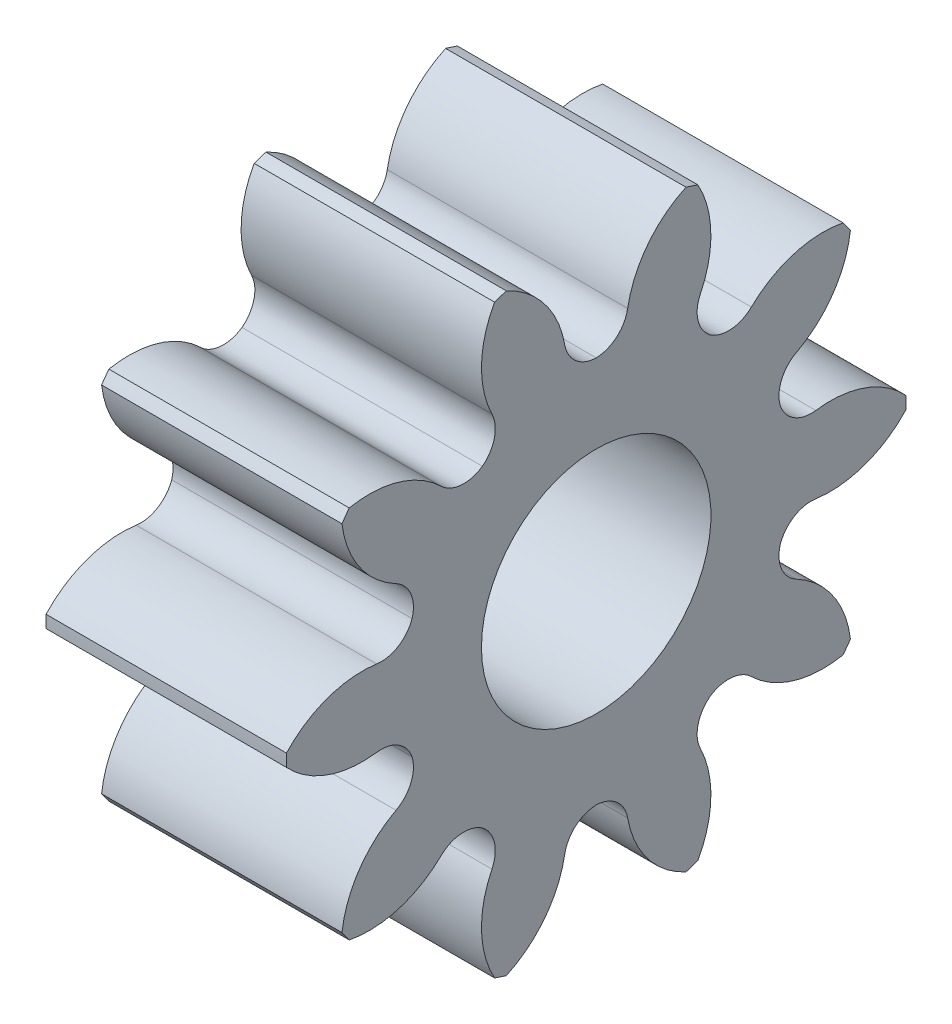
from build123d import *

# Parameters (mm, degrees)
BASPROSKE_W        = 10
BASPROSKE_H        = 6.75
TOOTHCUT_DEPTH     = 14.824796563
TEETHCUTS_COUNT    = 10
TEETHCUTS_ANGLE    = 324
BORSKE_R           = 2.5
BORE_DEPTH         = 50.0000508
SCALE1_SCALE       = 1.05
FILLET1_R          = 0.75
CUT_EXTRUDE1_START = -10.5
SKETCH1_R          = 10.265831804
CUT_EXTRUDE1_DEPTH = 5


with BuildPart() as part:
    # BasProSke → Base-Revolve (revolve)
    with BuildSketch(Plane(origin=(0, 0, 0), x_dir=(1, 0, 0), z_dir=(0, 1, 0)), mode=Mode.PRIVATE) as base_revolve_sk:
        with Locations((5, 3.375)):
            Rectangle(BASPROSKE_W, BASPROSKE_H)
    revolve(base_revolve_sk.sketch.rotate(Axis((-10, 0, 0), (1, 0, 0)), 180), axis=Axis((-10, 0, 0), (1, 0, 0)))

    # TooCutSke → ToothCut (cut, through all)
    with BuildSketch(Plane(origin=(0, 0, 0), x_dir=(0, 0, -1), z_dir=(1, 0, 0))):
        with BuildLine():
            ThreePointArc((0.665884296, 4.164854519), (0, 4.21775), (-0.665884296, 4.164854519))
            ThreePointArc((-0.665884296, 4.164854519), (-0.949936307, 5.537806691), (-1.991778305, 6.476022262))
            ThreePointArc((-1.991778305, 6.476022262), (0, 6.7754), (1.991778305, 6.476022262))
            ThreePointArc((1.991778305, 6.476022262), (0.949936307, 5.537806691), (0.665884296, 4.164854519))
        make_face()
    toothcut = extrude(amount=TOOTHCUT_DEPTH, mode=Mode.SUBTRACT)

    # TeethCuts: ToothCut ×10 about axis
    teethcuts_axis = Axis((-10, 0, 0), (1, 0, 0))
    for i in range(1, TEETHCUTS_COUNT):
        add(toothcut.rotate(teethcuts_axis, i * TEETHCUTS_ANGLE / (TEETHCUTS_COUNT - 1)), mode=Mode.SUBTRACT)

    # BorSke → Bore (cut, symmetric)
    with BuildSketch(Plane(origin=(0, 0, 0), x_dir=(0, 0, -1), z_dir=(1, 0, 0))):
        with Locations(Location((0, 0, 0), (0, 0, 180))):
            Circle(BORSKE_R)
    extrude(amount=BORE_DEPTH, both=True, mode=Mode.SUBTRACT)


with BuildPart() as part_1:
    # Scale1: scaled about (5, 0, 0)
    add(part.part.scale(SCALE1_SCALE).moved(Location((-0.25, 0, 0))))

    # Fillet1
    # the kernel refuses this fillet: 0.75 mm, written as the material it adds along each edge
    with BuildSketch(Plane(origin=(-0.25, 3.126943172, -3.136089365), x_dir=(0, 0.6486282387058202, 0.7611053855763902), z_dir=(1, 0, 0)), Plane(origin=(-0.25, 0.686403088, -4.375120673), x_dir=(0, 0.9721177892266772, 0.23449307850987308), z_dir=(1, 0, 0)), Plane(origin=(-0.25, -2.016319645, -3.94300459), x_dir=(0, 0.9242913853313495, -0.38168761442081794), z_dir=(1, 0, 0)), Plane(origin=(-0.25, -3.948876807, -2.004794771), x_dir=(0, 0.5234170877481713, -0.8520766117276212), z_dir=(1, 0, 0)), Plane(origin=(-0.25, -4.373097245, 0.69917851), x_dir=(0, -0.07738474706232469, -0.9970013043733192), z_dir=(1, 0, 0))) as fillet1_piece_1:
        with BuildLine():
            CenterArc((0.778083465, -0.747536247), FILLET1_R, 94.645414963, 79.810658705)
            ThreePointArc((0.031591647, -0.675079607), (0.040059779, -0.336404325), (0, 0))
            ThreePointArc((0, 0), (0.358670863, -0.01454809), (0.717341725, 0))
        make_face()
    extrude(amount=10.5)
    with BuildSketch(Plane(origin=(-0.25, 3.948876807, -2.004794771), x_dir=(0, 0.8266776070022068, -0.562675869467587), z_dir=(1, 0, 0)), Plane(origin=(-0.25, 2.016319645, -3.94300459), x_dir=(0, 0.3380636550401047, -0.9411232465203083), z_dir=(1, 0, 0)), Plane(origin=(-0.25, -0.686403088, -4.375120673), x_dir=(0, -0.27967912278629736, -0.9600935310049158), z_dir=(1, 0, 0)), Plane(origin=(-0.25, -3.126943172, -3.136089365), x_dir=(0, -0.7905939816520889, -0.6123407190245448), z_dir=(1, 0, 0)), Plane(origin=(-0.25, -4.373097245, -0.69917851), x_dir=(0, -0.9995288108278918, -0.030694565072345244), z_dir=(1, 0, 0))) as fillet1_piece_2:
        with BuildLine():
            CenterArc((0.78309116, -0.742288727), FILLET1_R, 98.223237645, 79.810658705)
            ThreePointArc((0.033532686, -0.716557541), (0.031298529, -0.357598709), (0, 0))
            ThreePointArc((0, 0), (0.337909199, -0.024290509), (0.675818399, 0))
        make_face()
    extrude(amount=10.5)
    with BuildSketch(Plane(origin=(-0.25, -3.948876807, 2.004794771), x_dir=(0, 0.5234170877481569, 0.8520766117276299), z_dir=(1, 0, 0)), Plane(origin=(-0.25, -2.016319645, 3.94300459), x_dir=(0, 0.9242913853313433, 0.38168761442083243), z_dir=(1, 0, 0)), Plane(origin=(-0.25, 0.686403088, 4.375120673), x_dir=(0, 0.9721177892266811, -0.23449307850985693), z_dir=(1, 0, 0)), Plane(origin=(-0.25, 3.126943172, 3.136089365), x_dir=(0, 0.6486282387058309, -0.761105385576381), z_dir=(1, 0, 0)), Plane(origin=(-0.25, 4.373097245, 0.69917851), x_dir=(0, 0.07738474706233216, -0.9970013043733188), z_dir=(1, 0, 0))) as fillet1_piece_3:
        with BuildLine():
            CenterArc((0.778083465, 0.747536247), FILLET1_R, 185.543926332, 79.810658705)
            ThreePointArc((0.031591647, 0.675079607), (0.040059779, 0.336404325), (0, 0))
            ThreePointArc((0, 0), (0.358670863, 0.01454809), (0.717341725, 0))
        make_face()
    extrude(amount=10.5)
    with BuildSketch(Plane(origin=(-0.25, -3.126943172, 3.136089365), x_dir=(0, -0.7905939816520986, 0.6123407190245325), z_dir=(1, 0, 0)), Plane(origin=(-0.25, -0.686403088, 4.375120673), x_dir=(0, -0.2796791227863126, 0.9600935310049113), z_dir=(1, 0, 0)), Plane(origin=(-0.25, 2.016319645, 3.94300459), x_dir=(0, 0.33806365504009167, 0.9411232465203131), z_dir=(1, 0, 0)), Plane(origin=(-0.25, 3.948876807, 2.004794771), x_dir=(0, 0.826677607002198, 0.5626758694676001), z_dir=(1, 0, 0)), Plane(origin=(-0.25, 4.373097245, -0.69917851), x_dir=(0, 0.9995288108278919, -0.030694565072338184), z_dir=(1, 0, 0))) as fillet1_piece_4:
        with BuildLine():
            CenterArc((0.78309116, 0.742288727), FILLET1_R, 181.96610365, 79.810658705)
            ThreePointArc((0.033532686, 0.716557541), (0.031298529, 0.357598709), (0, 0))
            ThreePointArc((0, 0), (0.337909199, 0.024290509), (0.675818399, 0))
        make_face()
    extrude(amount=10.5)

    # Sketch1 → Cut-Extrude1 (cut)
    with BuildSketch(Plane(origin=(10.25, 0, 0), x_dir=(0, 0, -1), z_dir=(1, 0, 0)).offset(CUT_EXTRUDE1_START)):
        Circle(SKETCH1_R)
    extrude(amount=CUT_EXTRUDE1_DEPTH, mode=Mode.SUBTRACT)


solid = part_1.part
